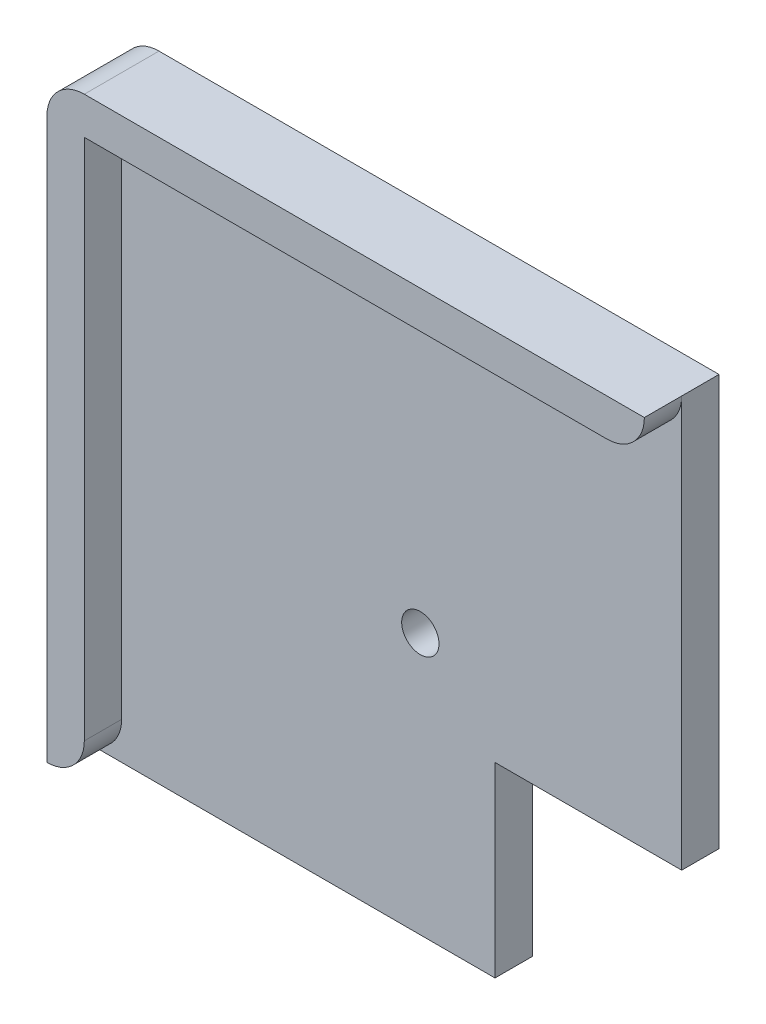
from build123d import *

# Parameters (mm, degrees)
SKETCH1_R                = 1
BOSS_EXTRUDE1_DEPTH      = 2
BOSS_EXTRUDE2_DEPTH      = 2
BOSS_EXTRUDE2_DEPTH_BACK = 2
FILLET1_R                = 2


with BuildPart() as part:
    # Sketch1 → Boss-Extrude1 (new body)
    with BuildSketch(Plane.XY):
        Polygon((-16, -14), (-16, 16), (14, 16), (14, -4), (4, -4), (4, -14), align=None)
        Circle(SKETCH1_R, mode=Mode.SUBTRACT)
    extrude(amount=BOSS_EXTRUDE1_DEPTH)

    # Sketch3 → Boss-Extrude2 (add, two sides: drawn at the far end of the back side and taken through both)
    with BuildSketch(Plane.XY.offset(2).offset(-BOSS_EXTRUDE2_DEPTH_BACK)):
        Polygon((-18, -14), (-16, -14), (-16, 16), (14, 16), (14, 18), (-18, 18), align=None)
    extrude(amount=BOSS_EXTRUDE2_DEPTH + BOSS_EXTRUDE2_DEPTH_BACK)

    # Fillet1
    fillet1_edges = [part.edges().sort_by_distance(p)[0] for p in [
        (14, 16, 3),
        (-16, -14, 3),
        (-18, 18, 2),
    ]]
    fillet(fillet1_edges, radius=FILLET1_R - 0.0001)  # a hair under: the kernel refuses the full size


solid = part.part
